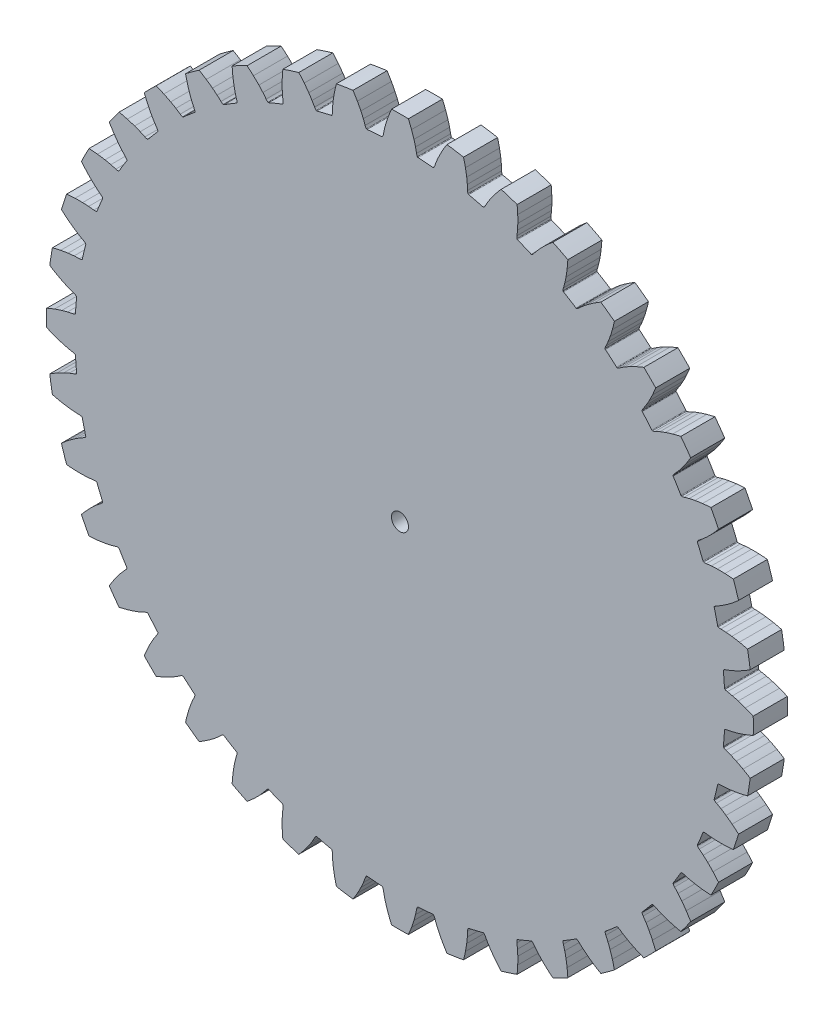
from build123d import *

# Parameters (mm, degrees)
BOSS_EXTRUDE1_DEPTH = 6.35
SKETCH2_R           = 1.5875
CUT_EXTRUDE1_DEPTH  = 94.418849447


with BuildPart() as part:
    # Model → Boss-Extrude1 (new body)
    with BuildSketch(Plane.XY):
        with BuildLine():
            ThreePointArc((60.432559989, -4.756145619), (60.482768647, -4.068159868), (60.525145286, -3.379647323))
            ThreePointArc((60.525145286, -3.379647323), (60.550130561, -3.301696422), (60.609923049, -3.245790562))
            ThreePointArc((60.609923049, -3.245790562), (60.826439878, -3.150337081), (61.055658386, -3.091602251))
            ThreePointArc((61.055658386, -3.091602251), (61.531607168, -3.002464951), (62.00435827, -2.897683768))
            ThreePointArc((62.00435827, -2.897683768), (62.546588484, -2.759880245), (63.084665609, -2.606660065))
            ThreePointArc((63.084665609, -2.606660065), (63.761308327, -2.391526525), (64.430648945, -2.154649038))
            ThreePointArc((64.430648945, -2.154649038), (65.162514979, -1.870027064), (65.885756381, -1.564152197))
            ThreePointArc((65.885756381, -1.564152197), (65.904320541, 0), (65.885756381, 1.564152197))
            ThreePointArc((65.885756381, 1.564152197), (65.162514976, 1.870027065), (64.430648939, 2.15464904))
            ThreePointArc((64.430648939, 2.15464904), (63.761308318, 2.391526528), (63.084665598, 2.606660069))
            ThreePointArc((63.084665598, 2.606660069), (62.546588471, 2.759880248), (62.004358256, 2.897683771))
            ThreePointArc((62.004358256, 2.897683771), (61.531607153, 3.002464954), (61.05565837, 3.091602254))
            ThreePointArc((61.05565837, 3.091602254), (60.82643988, 3.150337078), (60.609923065, 3.245790548))
            ThreePointArc((60.609923065, 3.245790548), (60.550130575, 3.301696402), (60.525145288, 3.379647296))
            ThreePointArc((60.525145288, 3.379647296), (60.43255999, 4.756145605), (60.308673633, 6.130180468))
            ThreePointArc((60.308673633, 6.130180468), (60.32115709, 6.211080222), (60.37146783, 6.275651394))
            ThreePointArc((60.37146783, 6.275651394), (60.570386763, 6.403800379), (60.78759506, 6.49766976))
            ThreePointArc((60.78759506, 6.49766976), (61.243739976, 6.660164425), (61.69427934, 6.837610144))
            ThreePointArc((61.69427934, 6.837610144), (62.20827658, 7.058540571), (62.715760166, 7.294048163))
            ThreePointArc((62.715760166, 7.294048163), (63.350417988, 7.612383294), (63.97446211, 7.951052367))
            ThreePointArc((63.97446211, 7.951052367), (64.652792972, 8.346659244), (65.319280701, 8.761908165))
            ThreePointArc((65.319280701, 8.761908165), (65.092928993, 10.309707128), (64.829906076, 11.851697941))
            ThreePointArc((64.829906076, 11.851697941), (64.067719602, 12.0406671), (63.300339364, 12.207295834))
            ThreePointArc((63.300339364, 12.207295834), (62.602183634, 12.336549025), (61.900217208, 12.443183673))
            ThreePointArc((61.900217208, 12.443183673), (61.344795787, 12.51034365), (60.787684105, 12.56162709))
            ThreePointArc((60.787684105, 12.56162709), (60.304361964, 12.591163676), (59.820328755, 12.604748755))
            ThreePointArc((59.820328755, 12.604748755), (59.584744174, 12.626902784), (59.355960828, 12.687310371))
            ThreePointArc((59.355960828, 12.687310371), (59.28815888, 12.733174325), (59.251286997, 12.806256954))
            ThreePointArc((59.251286997, 12.806256954), (58.944509801, 14.151324754), (58.607202282, 15.489062871))
            ThreePointArc((58.607202282, 15.489062871), (58.606876537, 15.570919457), (58.646466712, 15.642565985))
            ThreePointArc((58.646466712, 15.642565985), (58.822889705, 15.800255021), (59.0227394, 15.926947577))
            ThreePointArc((59.0227394, 15.926947577), (59.44784865, 16.158798449), (59.8650825, 16.404539401))
            ThreePointArc((59.8650825, 16.404539401), (60.338190448, 16.703156691), (60.802584565, 17.015152717))
            ThreePointArc((60.802584565, 17.015152717), (61.379630111, 17.428850971), (61.943011698, 17.860972475))
            ThreePointArc((61.943011698, 17.860972475), (62.551104632, 18.3578231), (63.144427548, 18.872221269))
            ThreePointArc((63.144427548, 18.872221269), (62.678733503, 20.36555505), (62.177728326, 21.847415549))
            ThreePointArc((62.177728326, 21.847415549), (61.395364343, 21.91482595), (60.611365352, 21.959358491))
            ThreePointArc((60.611365352, 21.959358491), (59.901585424, 21.977804742), (59.191580035, 21.973314798))
            ThreePointArc((59.191580035, 21.973314798), (58.632490638, 21.952760872), (58.074215428, 21.916261459))
            ThreePointArc((58.074215428, 21.916261459), (57.592223245, 21.869826161), (57.112024113, 21.807524509))
            ThreePointArc((57.112024113, 21.807524509), (56.875874316, 21.792552237), (56.640457844, 21.816426506))
            ThreePointArc((56.640457844, 21.816426506), (56.566315947, 21.851119237), (56.518465376, 21.917534065))
            ThreePointArc((56.518465376, 21.917534065), (56.005050155, 23.198051321), (55.462627105, 24.466553141))
            ThreePointArc((55.462627105, 24.466553141), (55.449500179, 24.547350979), (55.477394947, 24.624308687))
            ThreePointArc((55.477394947, 24.624308687), (55.62697788, 24.807654946), (55.804548012, 24.964051086))
            ThreePointArc((55.804548012, 24.964051086), (56.188153994, 25.259549228), (56.561808649, 25.567534455))
            ThreePointArc((56.561808649, 25.567534455), (56.982377817, 25.936485659), (57.39224754, 26.317287741))
            ThreePointArc((57.39224754, 26.317287741), (57.897472032, 26.816162495), (58.386318762, 27.331096163))
            ThreePointArc((58.386318762, 27.331096163), (58.9092005, 27.916956425), (59.414749024, 28.517837652))
            ThreePointArc((59.414749024, 28.517837652), (58.721179574, 29.919935417), (57.994528549, 31.305177278))
            ThreePointArc((57.994528549, 31.305177278), (57.211251454, 31.249369054), (56.429938368, 31.170708862))
            ThreePointArc((56.429938368, 31.170708862), (55.726011378, 31.077893966), (55.025449716, 30.962389988))
            ThreePointArc((55.025449716, 30.962389988), (54.47645898, 30.854628264), (53.930766831, 30.731244736))
            ThreePointArc((53.930766831, 30.731244736), (53.461972852, 30.609980944), (52.997431894, 30.473326634))
            ThreePointArc((52.997431894, 30.473326634), (52.766531672, 30.421596728), (52.530278809, 30.408349816))
            ThreePointArc((52.530278809, 30.408349816), (52.451622583, 30.431017074), (52.393971564, 30.489128746))
            ThreePointArc((52.393971564, 30.489128746), (51.686560304, 31.673564875), (50.952377978, 32.841595673))
            ThreePointArc((50.952377978, 32.841595673), (50.9267731, 32.919345252), (50.942285599, 32.999719186))
            ThreePointArc((50.942285599, 32.999719186), (51.061345244, 33.204208074), (51.212263446, 33.386456807))
            ThreePointArc((51.212263446, 33.386456807), (51.544920509, 33.738326073), (51.865795351, 34.100971957))
            ThreePointArc((51.865795351, 34.100971957), (52.22346993, 34.531172272), (52.568722907, 34.9714038))
            ThreePointArc((52.568722907, 34.9714038), (52.989686042, 35.5431711), (53.391960884, 36.128237557))
            ThreePointArc((53.391960884, 36.128237557), (53.816756344, 36.788681632), (54.222082193, 37.461250227))
            ThreePointArc((54.222082193, 37.461250227), (53.31771532, 38.737587676), (52.383311005, 39.992101646))
            ThreePointArc((52.383311005, 39.992101646), (51.618407681, 39.814448981), (50.859019021, 39.614532932))
            ThreePointArc((50.859019021, 39.614532932), (50.178277989, 39.4127423), (49.504410207, 39.189068378))
            ThreePointArc((49.504410207, 39.189068378), (48.979036105, 38.996752308), (48.459363768, 38.789522776))
            ThreePointArc((48.459363768, 38.789522776), (48.015311257, 38.596416407), (47.577867013, 38.388774323))
            ThreePointArc((47.577867013, 38.388774323), (47.357901896, 38.301560545), (47.126629971, 38.251518634))
            ThreePointArc((47.126629971, 38.251518634), (47.045396194, 38.261602276), (46.979364286, 38.309979891))
            ThreePointArc((46.979364286, 38.309979891), (46.095375801, 39.369170143), (45.187512204, 40.407969124))
            ThreePointArc((45.187512204, 40.407969124), (45.150059851, 40.480755991), (45.152808112, 40.562567078))
            ThreePointArc((45.152808112, 40.562567078), (45.238412826, 40.783163401), (45.358962991, 40.986777158))
            ThreePointArc((45.358962991, 40.986777158), (45.632480013, 41.386353359), (45.892674038, 41.794730354))
            ThreePointArc((45.892674038, 41.794730354), (46.178646894, 42.275586821), (46.45078185, 42.764407833))
            ThreePointArc((46.45078185, 42.764407833), (46.777118118, 43.394988872), (47.082915731, 44.03578184))
            ThreePointArc((47.082915731, 44.03578184), (47.399165039, 44.754547403), (47.694287746, 45.482242495))
            ThreePointArc((47.694287746, 45.482242495), (46.601391964, 46.601391964), (45.482242495, 47.694287746))
            ThreePointArc((45.482242495, 47.694287746), (44.7545474, 47.399165038), (44.035781834, 47.082915728))
            ThreePointArc((44.035781834, 47.082915728), (43.394988864, 46.777118114), (42.764407822, 46.450781844))
            ThreePointArc((42.764407822, 46.450781844), (42.275586809, 46.178646887), (41.794730341, 45.89267403))
            ThreePointArc((41.794730341, 45.89267403), (41.386353346, 45.632480004), (40.986777145, 45.358962982))
            ThreePointArc((40.986777145, 45.358962982), (40.783163404, 45.238412825), (40.5625671, 45.152808114))
            ThreePointArc((40.5625671, 45.152808114), (40.480756016, 45.150059846), (40.407969144, 45.187512186))
            ThreePointArc((40.407969144, 45.187512186), (39.369170163, 46.095375783), (38.309979911, 46.979364269))
            ThreePointArc((38.309979911, 46.979364269), (38.261602284, 47.04539617), (38.251518636, 47.12662995))
            ThreePointArc((38.251518636, 47.12662995), (38.301560546, 47.357901893), (38.38877433, 47.577867028))
            ThreePointArc((38.38877433, 47.577867028), (38.596416414, 48.015311271), (38.789522782, 48.459363781))
            ThreePointArc((38.789522782, 48.459363781), (38.996752313, 48.979036118), (39.189068382, 49.504410218))
            ThreePointArc((39.189068382, 49.504410218), (39.412742303, 50.178277998), (39.614532934, 50.859019027))
            ThreePointArc((39.614532934, 50.859019027), (39.814448982, 51.618407685), (39.992101646, 52.383311005))
            ThreePointArc((39.992101646, 52.383311005), (38.737587676, 53.31771532), (37.461250227, 54.222082193))
            ThreePointArc((37.461250227, 54.222082193), (36.788681629, 53.816756342), (36.128237552, 53.39196088))
            ThreePointArc((36.128237552, 53.39196088), (35.543171093, 52.989686036), (34.97140379, 52.568722899))
            ThreePointArc((34.97140379, 52.568722899), (34.531172261, 52.223469921), (34.100971945, 51.865795341))
            ThreePointArc((34.100971945, 51.865795341), (33.738326061, 51.544920498), (33.386456796, 51.212263435))
            ThreePointArc((33.386456796, 51.212263435), (33.204208077, 51.061345244), (32.999719207, 50.942285604))
            ThreePointArc((32.999719207, 50.942285604), (32.919345277, 50.926773099), (32.841595695, 50.952377963))
            ThreePointArc((32.841595695, 50.952377963), (31.673564898, 51.68656029), (30.48912877, 52.39397155))
            ThreePointArc((30.48912877, 52.39397155), (30.431017086, 52.451622561), (30.408349821, 52.530278788))
            ThreePointArc((30.408349821, 52.530278788), (30.42159673, 52.766531669), (30.473326639, 52.997431909))
            ThreePointArc((30.473326639, 52.997431909), (30.609980948, 53.461972867), (30.731244739, 53.930766845))
            ThreePointArc((30.731244739, 53.930766845), (30.854628267, 54.476458994), (30.96238999, 55.025449729))
            ThreePointArc((30.96238999, 55.025449729), (31.077893968, 55.726011388), (31.170708863, 56.429938375))
            ThreePointArc((31.170708863, 56.429938375), (31.249369054, 57.211251458), (31.305177278, 57.994528549))
            ThreePointArc((31.305177278, 57.994528549), (29.919935417, 58.721179574), (28.517837652, 59.414749024))
            ThreePointArc((28.517837652, 59.414749024), (27.916956423, 58.909200498), (27.331096158, 58.386318757))
            ThreePointArc((27.331096158, 58.386318757), (26.816162488, 57.897472026), (26.317287733, 57.392247531))
            ThreePointArc((26.317287733, 57.392247531), (25.93648565, 56.982377807), (25.567534445, 56.561808638))
            ThreePointArc((25.567534445, 56.561808638), (25.259549218, 56.188153982), (24.964051077, 55.804547999))
            ThreePointArc((24.964051077, 55.804547999), (24.807654948, 55.626977881), (24.624308707, 55.477394955))
            ThreePointArc((24.624308707, 55.477394955), (24.547351004, 55.449500182), (24.466553165, 55.462627094))
            ThreePointArc((24.466553165, 55.462627094), (23.198051346, 56.005050144), (21.91753409, 56.518465366))
            ThreePointArc((21.91753409, 56.518465366), (21.851119252, 56.566315927), (21.816426515, 56.640457824))
            ThreePointArc((21.816426515, 56.640457824), (21.792552239, 56.875874313), (21.807524511, 57.112024129))
            ThreePointArc((21.807524511, 57.112024129), (21.869826163, 57.59222326), (21.91626146, 58.074215443))
            ThreePointArc((21.91626146, 58.074215443), (21.952760873, 58.632490652), (21.973314799, 59.191580047))
            ThreePointArc((21.973314799, 59.191580047), (21.977804742, 59.901585433), (21.95935849, 60.611365359))
            ThreePointArc((21.95935849, 60.611365359), (21.91482595, 61.395364346), (21.847415549, 62.177728326))
            ThreePointArc((21.847415549, 62.177728326), (20.36555505, 62.678733503), (18.872221269, 63.144427548))
            ThreePointArc((18.872221269, 63.144427548), (18.357823098, 62.551104629), (17.860972471, 61.943011693))
            ThreePointArc((17.860972471, 61.943011693), (17.428850966, 61.379630103), (17.01515271, 60.802584555))
            ThreePointArc((17.01515271, 60.802584555), (16.703156684, 60.338190437), (16.404539394, 59.865082488))
            ThreePointArc((16.404539394, 59.865082488), (16.158798442, 59.447848637), (15.92694757, 59.022739386))
            ThreePointArc((15.92694757, 59.022739386), (15.800255024, 58.822889706), (15.642566004, 58.646466723))
            ThreePointArc((15.642566004, 58.646466723), (15.570919481, 58.606876544), (15.489062897, 58.607202275))
            ThreePointArc((15.489062897, 58.607202275), (14.15132478, 58.944509794), (12.806256981, 59.251286991))
            ThreePointArc((12.806256981, 59.251286991), (12.733174343, 59.288158863), (12.687310383, 59.35596081))
            ThreePointArc((12.687310383, 59.35596081), (12.626902786, 59.584744172), (12.604748755, 59.820328771))
            ThreePointArc((12.604748755, 59.820328771), (12.591163676, 60.304361979), (12.561627088, 60.78768412))
            ThreePointArc((12.561627088, 60.78768412), (12.510343649, 61.3447958), (12.443183671, 61.90021722))
            ThreePointArc((12.443183671, 61.90021722), (12.336549023, 62.602183643), (12.207295833, 63.300339371))
            ThreePointArc((12.207295833, 63.300339371), (12.040667099, 64.067719605), (11.851697941, 64.829906076))
            ThreePointArc((11.851697941, 64.829906076), (10.309707128, 65.092928993), (8.761908165, 65.319280701))
            ThreePointArc((8.761908165, 65.319280701), (8.346659242, 64.652792969), (7.951052364, 63.974462104))
            ThreePointArc((7.951052364, 63.974462104), (7.612383289, 63.35041798), (7.294048157, 62.715760155))
            ThreePointArc((7.294048157, 62.715760155), (7.058540565, 62.208276567), (6.837610138, 61.694279326))
            ThreePointArc((6.837610138, 61.694279326), (6.66016442, 61.243739962), (6.497669755, 60.787595044))
            ThreePointArc((6.497669755, 60.787595044), (6.403800382, 60.570386765), (6.27565141, 60.371467844))
            ThreePointArc((6.27565141, 60.371467844), (6.211080244, 60.3211571), (6.130180495, 60.30867363))
            ThreePointArc((6.130180495, 60.30867363), (4.756145632, 60.432559988), (3.379647323, 60.525145286))
            ThreePointArc((3.379647323, 60.525145286), (3.301696422, 60.550130561), (3.245790562, 60.609923049))
            ThreePointArc((3.245790562, 60.609923049), (3.150337081, 60.826439878), (3.091602251, 61.055658386))
            ThreePointArc((3.091602251, 61.055658386), (3.002464951, 61.531607168), (2.897683768, 62.00435827))
            ThreePointArc((2.897683768, 62.00435827), (2.759880245, 62.546588484), (2.606660065, 63.084665609))
            ThreePointArc((2.606660065, 63.084665609), (2.391526525, 63.761308327), (2.154649038, 64.430648945))
            ThreePointArc((2.154649038, 64.430648945), (1.870027064, 65.162514979), (1.564152197, 65.885756381))
            ThreePointArc((1.564152197, 65.885756381), (0, 65.904320541), (-1.564152197, 65.885756381))
            ThreePointArc((-1.564152197, 65.885756381), (-1.870027065, 65.162514976), (-2.15464904, 64.430648939))
            ThreePointArc((-2.15464904, 64.430648939), (-2.391526528, 63.761308318), (-2.606660069, 63.084665598))
            ThreePointArc((-2.606660069, 63.084665598), (-2.759880248, 62.546588471), (-2.897683771, 62.004358256))
            ThreePointArc((-2.897683771, 62.004358256), (-3.002464954, 61.531607153), (-3.091602254, 61.05565837))
            ThreePointArc((-3.091602254, 61.05565837), (-3.150337078, 60.82643988), (-3.245790548, 60.609923065))
            ThreePointArc((-3.245790548, 60.609923065), (-3.301696402, 60.550130575), (-3.379647296, 60.525145288))
            ThreePointArc((-3.379647296, 60.525145288), (-4.756145605, 60.43255999), (-6.130180468, 60.308673633))
            ThreePointArc((-6.130180468, 60.308673633), (-6.211080222, 60.32115709), (-6.275651394, 60.37146783))
            ThreePointArc((-6.275651394, 60.37146783), (-6.403800379, 60.570386763), (-6.49766976, 60.78759506))
            ThreePointArc((-6.49766976, 60.78759506), (-6.660164425, 61.243739976), (-6.837610144, 61.69427934))
            ThreePointArc((-6.837610144, 61.69427934), (-7.058540571, 62.20827658), (-7.294048163, 62.715760166))
            ThreePointArc((-7.294048163, 62.715760166), (-7.612383294, 63.350417988), (-7.951052367, 63.97446211))
            ThreePointArc((-7.951052367, 63.97446211), (-8.346659244, 64.652792972), (-8.761908165, 65.319280701))
            ThreePointArc((-8.761908165, 65.319280701), (-10.309707128, 65.092928993), (-11.851697941, 64.829906076))
            ThreePointArc((-11.851697941, 64.829906076), (-12.0406671, 64.067719602), (-12.207295834, 63.300339364))
            ThreePointArc((-12.207295834, 63.300339364), (-12.336549025, 62.602183634), (-12.443183673, 61.900217208))
            ThreePointArc((-12.443183673, 61.900217208), (-12.51034365, 61.344795787), (-12.56162709, 60.787684105))
            ThreePointArc((-12.56162709, 60.787684105), (-12.591163676, 60.304361964), (-12.604748755, 59.820328755))
            ThreePointArc((-12.604748755, 59.820328755), (-12.626902784, 59.584744174), (-12.687310371, 59.355960828))
            ThreePointArc((-12.687310371, 59.355960828), (-12.733174325, 59.28815888), (-12.806256954, 59.251286997))
            ThreePointArc((-12.806256954, 59.251286997), (-14.151324754, 58.944509801), (-15.489062871, 58.607202282))
            ThreePointArc((-15.489062871, 58.607202282), (-15.570919457, 58.606876537), (-15.642565985, 58.646466712))
            ThreePointArc((-15.642565985, 58.646466712), (-15.800255021, 58.822889705), (-15.926947577, 59.0227394))
            ThreePointArc((-15.926947577, 59.0227394), (-16.158798449, 59.44784865), (-16.404539401, 59.8650825))
            ThreePointArc((-16.404539401, 59.8650825), (-16.703156691, 60.338190448), (-17.015152717, 60.802584565))
            ThreePointArc((-17.015152717, 60.802584565), (-17.428850971, 61.379630111), (-17.860972475, 61.943011698))
            ThreePointArc((-17.860972475, 61.943011698), (-18.3578231, 62.551104632), (-18.872221269, 63.144427548))
            ThreePointArc((-18.872221269, 63.144427548), (-20.36555505, 62.678733503), (-21.847415549, 62.177728326))
            ThreePointArc((-21.847415549, 62.177728326), (-21.91482595, 61.395364343), (-21.959358491, 60.611365352))
            ThreePointArc((-21.959358491, 60.611365352), (-21.977804742, 59.901585424), (-21.973314798, 59.191580035))
            ThreePointArc((-21.973314798, 59.191580035), (-21.952760872, 58.632490638), (-21.916261459, 58.074215428))
            ThreePointArc((-21.916261459, 58.074215428), (-21.869826161, 57.592223245), (-21.807524509, 57.112024113))
            ThreePointArc((-21.807524509, 57.112024113), (-21.792552237, 56.875874316), (-21.816426506, 56.640457844))
            ThreePointArc((-21.816426506, 56.640457844), (-21.851119237, 56.566315947), (-21.917534065, 56.518465376))
            ThreePointArc((-21.917534065, 56.518465376), (-23.198051321, 56.005050155), (-24.466553141, 55.462627105))
            ThreePointArc((-24.466553141, 55.462627105), (-24.547350979, 55.449500179), (-24.624308687, 55.477394947))
            ThreePointArc((-24.624308687, 55.477394947), (-24.807654946, 55.62697788), (-24.964051086, 55.804548012))
            ThreePointArc((-24.964051086, 55.804548012), (-25.259549228, 56.188153994), (-25.567534455, 56.561808649))
            ThreePointArc((-25.567534455, 56.561808649), (-25.936485659, 56.982377817), (-26.317287741, 57.39224754))
            ThreePointArc((-26.317287741, 57.39224754), (-26.816162495, 57.897472032), (-27.331096163, 58.386318762))
            ThreePointArc((-27.331096163, 58.386318762), (-27.916956425, 58.9092005), (-28.517837652, 59.414749024))
            ThreePointArc((-28.517837652, 59.414749024), (-29.919935417, 58.721179574), (-31.305177278, 57.994528549))
            ThreePointArc((-31.305177278, 57.994528549), (-31.249369054, 57.211251454), (-31.170708862, 56.429938368))
            ThreePointArc((-31.170708862, 56.429938368), (-31.077893966, 55.726011378), (-30.962389988, 55.025449716))
            ThreePointArc((-30.962389988, 55.025449716), (-30.854628264, 54.47645898), (-30.731244736, 53.930766831))
            ThreePointArc((-30.731244736, 53.930766831), (-30.609980944, 53.461972852), (-30.473326634, 52.997431894))
            ThreePointArc((-30.473326634, 52.997431894), (-30.421596728, 52.766531672), (-30.408349816, 52.530278809))
            ThreePointArc((-30.408349816, 52.530278809), (-30.431017074, 52.451622583), (-30.489128746, 52.393971564))
            ThreePointArc((-30.489128746, 52.393971564), (-31.673564875, 51.686560304), (-32.841595673, 50.952377978))
            ThreePointArc((-32.841595673, 50.952377978), (-32.919345252, 50.9267731), (-32.999719186, 50.942285599))
            ThreePointArc((-32.999719186, 50.942285599), (-33.204208074, 51.061345244), (-33.386456807, 51.212263446))
            ThreePointArc((-33.386456807, 51.212263446), (-33.738326073, 51.544920509), (-34.100971957, 51.865795351))
            ThreePointArc((-34.100971957, 51.865795351), (-34.531172272, 52.22346993), (-34.9714038, 52.568722907))
            ThreePointArc((-34.9714038, 52.568722907), (-35.5431711, 52.989686042), (-36.128237557, 53.391960884))
            ThreePointArc((-36.128237557, 53.391960884), (-36.788681632, 53.816756344), (-37.461250227, 54.222082193))
            ThreePointArc((-37.461250227, 54.222082193), (-38.737587676, 53.31771532), (-39.992101646, 52.383311005))
            ThreePointArc((-39.992101646, 52.383311005), (-39.814448981, 51.618407681), (-39.614532932, 50.859019021))
            ThreePointArc((-39.614532932, 50.859019021), (-39.4127423, 50.178277989), (-39.189068378, 49.504410207))
            ThreePointArc((-39.189068378, 49.504410207), (-38.996752308, 48.979036105), (-38.789522776, 48.459363768))
            ThreePointArc((-38.789522776, 48.459363768), (-38.596416407, 48.015311257), (-38.388774323, 47.577867013))
            ThreePointArc((-38.388774323, 47.577867013), (-38.301560545, 47.357901896), (-38.251518634, 47.126629971))
            ThreePointArc((-38.251518634, 47.126629971), (-38.261602276, 47.045396194), (-38.309979891, 46.979364286))
            ThreePointArc((-38.309979891, 46.979364286), (-39.369170143, 46.095375801), (-40.407969124, 45.187512204))
            ThreePointArc((-40.407969124, 45.187512204), (-40.480755991, 45.150059851), (-40.562567078, 45.152808112))
            ThreePointArc((-40.562567078, 45.152808112), (-40.783163401, 45.238412826), (-40.986777158, 45.358962991))
            ThreePointArc((-40.986777158, 45.358962991), (-41.386353359, 45.632480013), (-41.794730354, 45.892674038))
            ThreePointArc((-41.794730354, 45.892674038), (-42.275586821, 46.178646894), (-42.764407833, 46.45078185))
            ThreePointArc((-42.764407833, 46.45078185), (-43.394988872, 46.777118118), (-44.03578184, 47.082915731))
            ThreePointArc((-44.03578184, 47.082915731), (-44.754547403, 47.399165039), (-45.482242495, 47.694287746))
            ThreePointArc((-45.482242495, 47.694287746), (-46.601391964, 46.601391964), (-47.694287746, 45.482242495))
            ThreePointArc((-47.694287746, 45.482242495), (-47.399165038, 44.7545474), (-47.082915728, 44.035781834))
            ThreePointArc((-47.082915728, 44.035781834), (-46.777118114, 43.394988864), (-46.450781844, 42.764407822))
            ThreePointArc((-46.450781844, 42.764407822), (-46.178646887, 42.275586809), (-45.89267403, 41.794730341))
            ThreePointArc((-45.89267403, 41.794730341), (-45.632480004, 41.386353346), (-45.358962982, 40.986777145))
            ThreePointArc((-45.358962982, 40.986777145), (-45.238412825, 40.783163404), (-45.152808114, 40.5625671))
            ThreePointArc((-45.152808114, 40.5625671), (-45.150059846, 40.480756016), (-45.187512186, 40.407969144))
            ThreePointArc((-45.187512186, 40.407969144), (-46.095375783, 39.369170163), (-46.979364269, 38.309979911))
            ThreePointArc((-46.979364269, 38.309979911), (-47.04539617, 38.261602284), (-47.12662995, 38.251518636))
            ThreePointArc((-47.12662995, 38.251518636), (-47.357901893, 38.301560546), (-47.577867028, 38.38877433))
            ThreePointArc((-47.577867028, 38.38877433), (-48.015311271, 38.596416414), (-48.459363781, 38.789522782))
            ThreePointArc((-48.459363781, 38.789522782), (-48.979036118, 38.996752313), (-49.504410218, 39.189068382))
            ThreePointArc((-49.504410218, 39.189068382), (-50.178277998, 39.412742303), (-50.859019027, 39.614532934))
            ThreePointArc((-50.859019027, 39.614532934), (-51.618407685, 39.814448982), (-52.383311005, 39.992101646))
            ThreePointArc((-52.383311005, 39.992101646), (-53.31771532, 38.737587676), (-54.222082193, 37.461250227))
            ThreePointArc((-54.222082193, 37.461250227), (-53.816756342, 36.788681629), (-53.39196088, 36.128237552))
            ThreePointArc((-53.39196088, 36.128237552), (-52.989686036, 35.543171093), (-52.568722899, 34.97140379))
            ThreePointArc((-52.568722899, 34.97140379), (-52.223469921, 34.531172261), (-51.865795341, 34.100971945))
            ThreePointArc((-51.865795341, 34.100971945), (-51.544920498, 33.738326061), (-51.212263435, 33.386456796))
            ThreePointArc((-51.212263435, 33.386456796), (-51.061345244, 33.204208077), (-50.942285604, 32.999719207))
            ThreePointArc((-50.942285604, 32.999719207), (-50.926773099, 32.919345277), (-50.952377963, 32.841595695))
            ThreePointArc((-50.952377963, 32.841595695), (-51.68656029, 31.673564898), (-52.39397155, 30.48912877))
            ThreePointArc((-52.39397155, 30.48912877), (-52.451622561, 30.431017086), (-52.530278788, 30.408349821))
            ThreePointArc((-52.530278788, 30.408349821), (-52.766531669, 30.42159673), (-52.997431909, 30.473326639))
            ThreePointArc((-52.997431909, 30.473326639), (-53.461972867, 30.609980948), (-53.930766845, 30.731244739))
            ThreePointArc((-53.930766845, 30.731244739), (-54.476458994, 30.854628267), (-55.025449729, 30.96238999))
            ThreePointArc((-55.025449729, 30.96238999), (-55.726011388, 31.077893968), (-56.429938375, 31.170708863))
            ThreePointArc((-56.429938375, 31.170708863), (-57.211251458, 31.249369054), (-57.994528549, 31.305177278))
            ThreePointArc((-57.994528549, 31.305177278), (-58.721179574, 29.919935417), (-59.414749024, 28.517837652))
            ThreePointArc((-59.414749024, 28.517837652), (-58.909200498, 27.916956423), (-58.386318757, 27.331096158))
            ThreePointArc((-58.386318757, 27.331096158), (-57.897472026, 26.816162488), (-57.392247531, 26.317287733))
            ThreePointArc((-57.392247531, 26.317287733), (-56.982377807, 25.93648565), (-56.561808638, 25.567534445))
            ThreePointArc((-56.561808638, 25.567534445), (-56.188153982, 25.259549218), (-55.804547999, 24.964051077))
            ThreePointArc((-55.804547999, 24.964051077), (-55.626977881, 24.807654948), (-55.477394955, 24.624308707))
            ThreePointArc((-55.477394955, 24.624308707), (-55.449500182, 24.547351004), (-55.462627094, 24.466553165))
            ThreePointArc((-55.462627094, 24.466553165), (-56.005050144, 23.198051346), (-56.518465366, 21.91753409))
            ThreePointArc((-56.518465366, 21.91753409), (-56.566315927, 21.851119252), (-56.640457824, 21.816426515))
            ThreePointArc((-56.640457824, 21.816426515), (-56.875874313, 21.792552239), (-57.112024129, 21.807524511))
            ThreePointArc((-57.112024129, 21.807524511), (-57.59222326, 21.869826163), (-58.074215443, 21.91626146))
            ThreePointArc((-58.074215443, 21.91626146), (-58.632490652, 21.952760873), (-59.191580047, 21.973314799))
            ThreePointArc((-59.191580047, 21.973314799), (-59.901585433, 21.977804742), (-60.611365359, 21.95935849))
            ThreePointArc((-60.611365359, 21.95935849), (-61.395364346, 21.91482595), (-62.177728326, 21.847415549))
            ThreePointArc((-62.177728326, 21.847415549), (-62.678733503, 20.36555505), (-63.144427548, 18.872221269))
            ThreePointArc((-63.144427548, 18.872221269), (-62.551104629, 18.357823098), (-61.943011693, 17.860972471))
            ThreePointArc((-61.943011693, 17.860972471), (-61.379630103, 17.428850966), (-60.802584555, 17.01515271))
            ThreePointArc((-60.802584555, 17.01515271), (-60.338190437, 16.703156684), (-59.865082488, 16.404539394))
            ThreePointArc((-59.865082488, 16.404539394), (-59.447848637, 16.158798442), (-59.022739386, 15.92694757))
            ThreePointArc((-59.022739386, 15.92694757), (-58.822889706, 15.800255024), (-58.646466723, 15.642566004))
            ThreePointArc((-58.646466723, 15.642566004), (-58.606876544, 15.570919481), (-58.607202275, 15.489062897))
            ThreePointArc((-58.607202275, 15.489062897), (-58.944509794, 14.15132478), (-59.251286991, 12.806256981))
            ThreePointArc((-59.251286991, 12.806256981), (-59.288158863, 12.733174343), (-59.35596081, 12.687310383))
            ThreePointArc((-59.35596081, 12.687310383), (-59.584744172, 12.626902786), (-59.820328771, 12.604748755))
            ThreePointArc((-59.820328771, 12.604748755), (-60.304361979, 12.591163676), (-60.78768412, 12.561627088))
            ThreePointArc((-60.78768412, 12.561627088), (-61.3447958, 12.510343649), (-61.90021722, 12.443183671))
            ThreePointArc((-61.90021722, 12.443183671), (-62.602183643, 12.336549023), (-63.300339371, 12.207295833))
            ThreePointArc((-63.300339371, 12.207295833), (-64.067719605, 12.040667099), (-64.829906076, 11.851697941))
            ThreePointArc((-64.829906076, 11.851697941), (-65.092928993, 10.309707128), (-65.319280701, 8.761908165))
            ThreePointArc((-65.319280701, 8.761908165), (-64.652792969, 8.346659242), (-63.974462104, 7.951052364))
            ThreePointArc((-63.974462104, 7.951052364), (-63.35041798, 7.612383289), (-62.715760155, 7.294048157))
            ThreePointArc((-62.715760155, 7.294048157), (-62.208276567, 7.058540565), (-61.694279326, 6.837610138))
            ThreePointArc((-61.694279326, 6.837610138), (-61.243739962, 6.66016442), (-60.787595044, 6.497669755))
            ThreePointArc((-60.787595044, 6.497669755), (-60.570386765, 6.403800382), (-60.371467844, 6.27565141))
            ThreePointArc((-60.371467844, 6.27565141), (-60.3211571, 6.211080244), (-60.30867363, 6.130180495))
            ThreePointArc((-60.30867363, 6.130180495), (-60.432559988, 4.756145632), (-60.525145286, 3.379647323))
            ThreePointArc((-60.525145286, 3.379647323), (-60.550130561, 3.301696422), (-60.609923049, 3.245790562))
            ThreePointArc((-60.609923049, 3.245790562), (-60.826439878, 3.150337081), (-61.055658386, 3.091602251))
            ThreePointArc((-61.055658386, 3.091602251), (-61.531607168, 3.002464951), (-62.00435827, 2.897683768))
            ThreePointArc((-62.00435827, 2.897683768), (-62.546588484, 2.759880245), (-63.084665609, 2.606660065))
            ThreePointArc((-63.084665609, 2.606660065), (-63.761308327, 2.391526525), (-64.430648945, 2.154649038))
            ThreePointArc((-64.430648945, 2.154649038), (-65.162514979, 1.870027064), (-65.885756381, 1.564152197))
            ThreePointArc((-65.885756381, 1.564152197), (-65.904320541, 0), (-65.885756381, -1.564152197))
            ThreePointArc((-65.885756381, -1.564152197), (-65.162514976, -1.870027065), (-64.430648939, -2.15464904))
            ThreePointArc((-64.430648939, -2.15464904), (-63.761308318, -2.391526528), (-63.084665598, -2.606660069))
            ThreePointArc((-63.084665598, -2.606660069), (-62.546588471, -2.759880248), (-62.004358256, -2.897683771))
            ThreePointArc((-62.004358256, -2.897683771), (-61.531607153, -3.002464954), (-61.05565837, -3.091602254))
            ThreePointArc((-61.05565837, -3.091602254), (-60.82643988, -3.150337078), (-60.609923065, -3.245790548))
            ThreePointArc((-60.609923065, -3.245790548), (-60.550130575, -3.301696402), (-60.525145288, -3.379647296))
            ThreePointArc((-60.525145288, -3.379647296), (-60.43255999, -4.756145605), (-60.308673633, -6.130180468))
            ThreePointArc((-60.308673633, -6.130180468), (-60.32115709, -6.211080222), (-60.37146783, -6.275651394))
            ThreePointArc((-60.37146783, -6.275651394), (-60.570386763, -6.403800379), (-60.78759506, -6.49766976))
            ThreePointArc((-60.78759506, -6.49766976), (-61.243739976, -6.660164425), (-61.69427934, -6.837610144))
            ThreePointArc((-61.69427934, -6.837610144), (-62.20827658, -7.058540571), (-62.715760166, -7.294048163))
            ThreePointArc((-62.715760166, -7.294048163), (-63.350417988, -7.612383294), (-63.97446211, -7.951052367))
            ThreePointArc((-63.97446211, -7.951052367), (-64.652792972, -8.346659244), (-65.319280701, -8.761908165))
            ThreePointArc((-65.319280701, -8.761908165), (-65.092928993, -10.309707128), (-64.829906076, -11.851697941))
            ThreePointArc((-64.829906076, -11.851697941), (-64.067719602, -12.0406671), (-63.300339364, -12.207295834))
            ThreePointArc((-63.300339364, -12.207295834), (-62.602183634, -12.336549025), (-61.900217208, -12.443183673))
            ThreePointArc((-61.900217208, -12.443183673), (-61.344795787, -12.51034365), (-60.787684105, -12.56162709))
            ThreePointArc((-60.787684105, -12.56162709), (-60.304361964, -12.591163676), (-59.820328755, -12.604748755))
            ThreePointArc((-59.820328755, -12.604748755), (-59.584744174, -12.626902784), (-59.355960828, -12.687310371))
            ThreePointArc((-59.355960828, -12.687310371), (-59.28815888, -12.733174325), (-59.251286997, -12.806256954))
            ThreePointArc((-59.251286997, -12.806256954), (-58.944509801, -14.151324754), (-58.607202282, -15.489062871))
            ThreePointArc((-58.607202282, -15.489062871), (-58.606876537, -15.570919457), (-58.646466712, -15.642565985))
            ThreePointArc((-58.646466712, -15.642565985), (-58.822889705, -15.800255021), (-59.0227394, -15.926947577))
            ThreePointArc((-59.0227394, -15.926947577), (-59.44784865, -16.158798449), (-59.8650825, -16.404539401))
            ThreePointArc((-59.8650825, -16.404539401), (-60.338190448, -16.703156691), (-60.802584565, -17.015152717))
            ThreePointArc((-60.802584565, -17.015152717), (-61.379630111, -17.428850971), (-61.943011698, -17.860972475))
            ThreePointArc((-61.943011698, -17.860972475), (-62.551104632, -18.3578231), (-63.144427548, -18.872221269))
            ThreePointArc((-63.144427548, -18.872221269), (-62.678733503, -20.36555505), (-62.177728326, -21.847415549))
            ThreePointArc((-62.177728326, -21.847415549), (-61.395364343, -21.91482595), (-60.611365352, -21.959358491))
            ThreePointArc((-60.611365352, -21.959358491), (-59.901585424, -21.977804742), (-59.191580035, -21.973314798))
            ThreePointArc((-59.191580035, -21.973314798), (-58.632490638, -21.952760872), (-58.074215428, -21.916261459))
            ThreePointArc((-58.074215428, -21.916261459), (-57.592223245, -21.869826161), (-57.112024113, -21.807524509))
            ThreePointArc((-57.112024113, -21.807524509), (-56.875874316, -21.792552237), (-56.640457844, -21.816426506))
            ThreePointArc((-56.640457844, -21.816426506), (-56.566315947, -21.851119237), (-56.518465376, -21.917534065))
            ThreePointArc((-56.518465376, -21.917534065), (-56.005050155, -23.198051321), (-55.462627105, -24.466553141))
            ThreePointArc((-55.462627105, -24.466553141), (-55.449500179, -24.547350979), (-55.477394947, -24.624308687))
            ThreePointArc((-55.477394947, -24.624308687), (-55.62697788, -24.807654946), (-55.804548012, -24.964051086))
            ThreePointArc((-55.804548012, -24.964051086), (-56.188153994, -25.259549228), (-56.561808649, -25.567534455))
            ThreePointArc((-56.561808649, -25.567534455), (-56.982377817, -25.936485659), (-57.39224754, -26.317287741))
            ThreePointArc((-57.39224754, -26.317287741), (-57.897472032, -26.816162495), (-58.386318762, -27.331096163))
            ThreePointArc((-58.386318762, -27.331096163), (-58.9092005, -27.916956425), (-59.414749024, -28.517837652))
            ThreePointArc((-59.414749024, -28.517837652), (-58.721179574, -29.919935417), (-57.994528549, -31.305177278))
            ThreePointArc((-57.994528549, -31.305177278), (-57.211251454, -31.249369054), (-56.429938368, -31.170708862))
            ThreePointArc((-56.429938368, -31.170708862), (-55.726011378, -31.077893966), (-55.025449716, -30.962389988))
            ThreePointArc((-55.025449716, -30.962389988), (-54.47645898, -30.854628264), (-53.930766831, -30.731244736))
            ThreePointArc((-53.930766831, -30.731244736), (-53.461972852, -30.609980944), (-52.997431894, -30.473326634))
            ThreePointArc((-52.997431894, -30.473326634), (-52.766531672, -30.421596728), (-52.530278809, -30.408349816))
            ThreePointArc((-52.530278809, -30.408349816), (-52.451622583, -30.431017074), (-52.393971564, -30.489128746))
            ThreePointArc((-52.393971564, -30.489128746), (-51.686560304, -31.673564875), (-50.952377978, -32.841595673))
            ThreePointArc((-50.952377978, -32.841595673), (-50.9267731, -32.919345252), (-50.942285599, -32.999719186))
            ThreePointArc((-50.942285599, -32.999719186), (-51.061345244, -33.204208074), (-51.212263446, -33.386456807))
            ThreePointArc((-51.212263446, -33.386456807), (-51.544920509, -33.738326073), (-51.865795351, -34.100971957))
            ThreePointArc((-51.865795351, -34.100971957), (-52.22346993, -34.531172272), (-52.568722907, -34.9714038))
            ThreePointArc((-52.568722907, -34.9714038), (-52.989686042, -35.5431711), (-53.391960884, -36.128237557))
            ThreePointArc((-53.391960884, -36.128237557), (-53.816756344, -36.788681632), (-54.222082193, -37.461250227))
            ThreePointArc((-54.222082193, -37.461250227), (-53.31771532, -38.737587676), (-52.383311005, -39.992101646))
            ThreePointArc((-52.383311005, -39.992101646), (-51.618407681, -39.814448981), (-50.859019021, -39.614532932))
            ThreePointArc((-50.859019021, -39.614532932), (-50.178277989, -39.4127423), (-49.504410207, -39.189068378))
            ThreePointArc((-49.504410207, -39.189068378), (-48.979036105, -38.996752308), (-48.459363768, -38.789522776))
            ThreePointArc((-48.459363768, -38.789522776), (-48.015311257, -38.596416407), (-47.577867013, -38.388774323))
            ThreePointArc((-47.577867013, -38.388774323), (-47.357901896, -38.301560545), (-47.126629971, -38.251518634))
            ThreePointArc((-47.126629971, -38.251518634), (-47.045396194, -38.261602276), (-46.979364286, -38.309979891))
            ThreePointArc((-46.979364286, -38.309979891), (-46.095375801, -39.369170143), (-45.187512204, -40.407969124))
            ThreePointArc((-45.187512204, -40.407969124), (-45.150059851, -40.480755991), (-45.152808112, -40.562567078))
            ThreePointArc((-45.152808112, -40.562567078), (-45.238412826, -40.783163401), (-45.358962991, -40.986777158))
            ThreePointArc((-45.358962991, -40.986777158), (-45.632480013, -41.386353359), (-45.892674038, -41.794730354))
            ThreePointArc((-45.892674038, -41.794730354), (-46.178646894, -42.275586821), (-46.45078185, -42.764407833))
            ThreePointArc((-46.45078185, -42.764407833), (-46.777118118, -43.394988872), (-47.082915731, -44.03578184))
            ThreePointArc((-47.082915731, -44.03578184), (-47.399165039, -44.754547403), (-47.694287746, -45.482242495))
            ThreePointArc((-47.694287746, -45.482242495), (-46.601391964, -46.601391964), (-45.482242495, -47.694287746))
            ThreePointArc((-45.482242495, -47.694287746), (-44.7545474, -47.399165038), (-44.035781834, -47.082915728))
            ThreePointArc((-44.035781834, -47.082915728), (-43.394988864, -46.777118114), (-42.764407822, -46.450781844))
            ThreePointArc((-42.764407822, -46.450781844), (-42.275586809, -46.178646887), (-41.794730341, -45.89267403))
            ThreePointArc((-41.794730341, -45.89267403), (-41.386353346, -45.632480004), (-40.986777145, -45.358962982))
            ThreePointArc((-40.986777145, -45.358962982), (-40.783163404, -45.238412825), (-40.5625671, -45.152808114))
            ThreePointArc((-40.5625671, -45.152808114), (-40.480756016, -45.150059846), (-40.407969144, -45.187512186))
            ThreePointArc((-40.407969144, -45.187512186), (-39.369170163, -46.095375783), (-38.309979911, -46.979364269))
            ThreePointArc((-38.309979911, -46.979364269), (-38.261602284, -47.04539617), (-38.251518636, -47.12662995))
            ThreePointArc((-38.251518636, -47.12662995), (-38.301560546, -47.357901893), (-38.38877433, -47.577867028))
            ThreePointArc((-38.38877433, -47.577867028), (-38.596416414, -48.015311271), (-38.789522782, -48.459363781))
            ThreePointArc((-38.789522782, -48.459363781), (-38.996752313, -48.979036118), (-39.189068382, -49.504410218))
            ThreePointArc((-39.189068382, -49.504410218), (-39.412742303, -50.178277998), (-39.614532934, -50.859019027))
            ThreePointArc((-39.614532934, -50.859019027), (-39.814448982, -51.618407685), (-39.992101646, -52.383311005))
            ThreePointArc((-39.992101646, -52.383311005), (-38.737587676, -53.31771532), (-37.461250227, -54.222082193))
            ThreePointArc((-37.461250227, -54.222082193), (-36.788681629, -53.816756342), (-36.128237552, -53.39196088))
            ThreePointArc((-36.128237552, -53.39196088), (-35.543171093, -52.989686036), (-34.97140379, -52.568722899))
            ThreePointArc((-34.97140379, -52.568722899), (-34.531172261, -52.223469921), (-34.100971945, -51.865795341))
            ThreePointArc((-34.100971945, -51.865795341), (-33.738326061, -51.544920498), (-33.386456796, -51.212263435))
            ThreePointArc((-33.386456796, -51.212263435), (-33.204208077, -51.061345244), (-32.999719207, -50.942285604))
            ThreePointArc((-32.999719207, -50.942285604), (-32.919345277, -50.926773099), (-32.841595695, -50.952377963))
            ThreePointArc((-32.841595695, -50.952377963), (-31.673564898, -51.68656029), (-30.48912877, -52.39397155))
            ThreePointArc((-30.48912877, -52.39397155), (-30.431017086, -52.451622561), (-30.408349821, -52.530278788))
            ThreePointArc((-30.408349821, -52.530278788), (-30.42159673, -52.766531669), (-30.473326639, -52.997431909))
            ThreePointArc((-30.473326639, -52.997431909), (-30.609980948, -53.461972867), (-30.731244739, -53.930766845))
            ThreePointArc((-30.731244739, -53.930766845), (-30.854628267, -54.476458994), (-30.96238999, -55.025449729))
            ThreePointArc((-30.96238999, -55.025449729), (-31.077893968, -55.726011388), (-31.170708863, -56.429938375))
            ThreePointArc((-31.170708863, -56.429938375), (-31.249369054, -57.211251458), (-31.305177278, -57.994528549))
            ThreePointArc((-31.305177278, -57.994528549), (-29.919935417, -58.721179574), (-28.517837652, -59.414749024))
            ThreePointArc((-28.517837652, -59.414749024), (-27.916956423, -58.909200498), (-27.331096158, -58.386318757))
            ThreePointArc((-27.331096158, -58.386318757), (-26.816162488, -57.897472026), (-26.317287733, -57.392247531))
            ThreePointArc((-26.317287733, -57.392247531), (-25.93648565, -56.982377807), (-25.567534445, -56.561808638))
            ThreePointArc((-25.567534445, -56.561808638), (-25.259549218, -56.188153982), (-24.964051077, -55.804547999))
            ThreePointArc((-24.964051077, -55.804547999), (-24.807654948, -55.626977881), (-24.624308707, -55.477394955))
            ThreePointArc((-24.624308707, -55.477394955), (-24.547351004, -55.449500182), (-24.466553165, -55.462627094))
            ThreePointArc((-24.466553165, -55.462627094), (-23.198051346, -56.005050144), (-21.91753409, -56.518465366))
            ThreePointArc((-21.91753409, -56.518465366), (-21.851119252, -56.566315927), (-21.816426515, -56.640457824))
            ThreePointArc((-21.816426515, -56.640457824), (-21.792552239, -56.875874313), (-21.807524511, -57.112024129))
            ThreePointArc((-21.807524511, -57.112024129), (-21.869826163, -57.59222326), (-21.91626146, -58.074215443))
            ThreePointArc((-21.91626146, -58.074215443), (-21.952760873, -58.632490652), (-21.973314799, -59.191580047))
            ThreePointArc((-21.973314799, -59.191580047), (-21.977804742, -59.901585433), (-21.95935849, -60.611365359))
            ThreePointArc((-21.95935849, -60.611365359), (-21.91482595, -61.395364346), (-21.847415549, -62.177728326))
            ThreePointArc((-21.847415549, -62.177728326), (-20.36555505, -62.678733503), (-18.872221269, -63.144427548))
            ThreePointArc((-18.872221269, -63.144427548), (-18.357823098, -62.551104629), (-17.860972471, -61.943011693))
            ThreePointArc((-17.860972471, -61.943011693), (-17.428850966, -61.379630103), (-17.01515271, -60.802584555))
            ThreePointArc((-17.01515271, -60.802584555), (-16.703156684, -60.338190437), (-16.404539394, -59.865082488))
            ThreePointArc((-16.404539394, -59.865082488), (-16.158798442, -59.447848637), (-15.92694757, -59.022739386))
            ThreePointArc((-15.92694757, -59.022739386), (-15.800255024, -58.822889706), (-15.642566004, -58.646466723))
            ThreePointArc((-15.642566004, -58.646466723), (-15.570919481, -58.606876544), (-15.489062897, -58.607202275))
            ThreePointArc((-15.489062897, -58.607202275), (-14.15132478, -58.944509794), (-12.806256981, -59.251286991))
            ThreePointArc((-12.806256981, -59.251286991), (-12.733174343, -59.288158863), (-12.687310383, -59.35596081))
            ThreePointArc((-12.687310383, -59.35596081), (-12.626902786, -59.584744172), (-12.604748755, -59.820328771))
            ThreePointArc((-12.604748755, -59.820328771), (-12.591163676, -60.304361979), (-12.561627088, -60.78768412))
            ThreePointArc((-12.561627088, -60.78768412), (-12.510343649, -61.3447958), (-12.443183671, -61.90021722))
            ThreePointArc((-12.443183671, -61.90021722), (-12.336549023, -62.602183643), (-12.207295833, -63.300339371))
            ThreePointArc((-12.207295833, -63.300339371), (-12.040667099, -64.067719605), (-11.851697941, -64.829906076))
            ThreePointArc((-11.851697941, -64.829906076), (-10.309707128, -65.092928993), (-8.761908165, -65.319280701))
            ThreePointArc((-8.761908165, -65.319280701), (-8.346659242, -64.652792969), (-7.951052364, -63.974462104))
            ThreePointArc((-7.951052364, -63.974462104), (-7.612383289, -63.35041798), (-7.294048157, -62.715760155))
            ThreePointArc((-7.294048157, -62.715760155), (-7.058540565, -62.208276567), (-6.837610138, -61.694279326))
            ThreePointArc((-6.837610138, -61.694279326), (-6.66016442, -61.243739962), (-6.497669755, -60.787595044))
            ThreePointArc((-6.497669755, -60.787595044), (-6.403800382, -60.570386765), (-6.27565141, -60.371467844))
            ThreePointArc((-6.27565141, -60.371467844), (-6.211080244, -60.3211571), (-6.130180495, -60.30867363))
            ThreePointArc((-6.130180495, -60.30867363), (-4.756145632, -60.432559988), (-3.379647323, -60.525145286))
            ThreePointArc((-3.379647323, -60.525145286), (-3.301696422, -60.550130561), (-3.245790562, -60.609923049))
            ThreePointArc((-3.245790562, -60.609923049), (-3.150337081, -60.826439878), (-3.091602251, -61.055658386))
            ThreePointArc((-3.091602251, -61.055658386), (-3.002464951, -61.531607168), (-2.897683768, -62.00435827))
            ThreePointArc((-2.897683768, -62.00435827), (-2.759880245, -62.546588484), (-2.606660065, -63.084665609))
            ThreePointArc((-2.606660065, -63.084665609), (-2.391526525, -63.761308327), (-2.154649038, -64.430648945))
            ThreePointArc((-2.154649038, -64.430648945), (-1.870027064, -65.162514979), (-1.564152197, -65.885756381))
            ThreePointArc((-1.564152197, -65.885756381), (0, -65.904320541), (1.564152197, -65.885756381))
            ThreePointArc((1.564152197, -65.885756381), (1.870027065, -65.162514976), (2.15464904, -64.430648939))
            ThreePointArc((2.15464904, -64.430648939), (2.391526528, -63.761308318), (2.606660069, -63.084665598))
            ThreePointArc((2.606660069, -63.084665598), (2.759880248, -62.546588471), (2.897683771, -62.004358256))
            ThreePointArc((2.897683771, -62.004358256), (3.002464954, -61.531607153), (3.091602254, -61.05565837))
            ThreePointArc((3.091602254, -61.05565837), (3.150337078, -60.82643988), (3.245790548, -60.609923065))
            ThreePointArc((3.245790548, -60.609923065), (3.301696402, -60.550130575), (3.379647296, -60.525145288))
            ThreePointArc((3.379647296, -60.525145288), (4.756145605, -60.43255999), (6.130180468, -60.308673633))
            ThreePointArc((6.130180468, -60.308673633), (6.211080222, -60.32115709), (6.275651394, -60.37146783))
            ThreePointArc((6.275651394, -60.37146783), (6.403800379, -60.570386763), (6.49766976, -60.78759506))
            ThreePointArc((6.49766976, -60.78759506), (6.660164425, -61.243739976), (6.837610144, -61.69427934))
            ThreePointArc((6.837610144, -61.69427934), (7.058540571, -62.20827658), (7.294048163, -62.715760166))
            ThreePointArc((7.294048163, -62.715760166), (7.612383294, -63.350417988), (7.951052367, -63.97446211))
            ThreePointArc((7.951052367, -63.97446211), (8.346659244, -64.652792972), (8.761908165, -65.319280701))
            ThreePointArc((8.761908165, -65.319280701), (10.309707128, -65.092928993), (11.851697941, -64.829906076))
            ThreePointArc((11.851697941, -64.829906076), (12.0406671, -64.067719602), (12.207295834, -63.300339364))
            ThreePointArc((12.207295834, -63.300339364), (12.336549025, -62.602183634), (12.443183673, -61.900217208))
            ThreePointArc((12.443183673, -61.900217208), (12.51034365, -61.344795787), (12.56162709, -60.787684105))
            ThreePointArc((12.56162709, -60.787684105), (12.591163676, -60.304361964), (12.604748755, -59.820328755))
            ThreePointArc((12.604748755, -59.820328755), (12.626902784, -59.584744174), (12.687310371, -59.355960828))
            ThreePointArc((12.687310371, -59.355960828), (12.733174325, -59.28815888), (12.806256954, -59.251286997))
            ThreePointArc((12.806256954, -59.251286997), (14.151324754, -58.944509801), (15.489062871, -58.607202282))
            ThreePointArc((15.489062871, -58.607202282), (15.570919457, -58.606876537), (15.642565985, -58.646466712))
            ThreePointArc((15.642565985, -58.646466712), (15.800255021, -58.822889705), (15.926947577, -59.0227394))
            ThreePointArc((15.926947577, -59.0227394), (16.158798449, -59.44784865), (16.404539401, -59.8650825))
            ThreePointArc((16.404539401, -59.8650825), (16.703156691, -60.338190448), (17.015152717, -60.802584565))
            ThreePointArc((17.015152717, -60.802584565), (17.428850971, -61.379630111), (17.860972475, -61.943011698))
            ThreePointArc((17.860972475, -61.943011698), (18.3578231, -62.551104632), (18.872221269, -63.144427548))
            ThreePointArc((18.872221269, -63.144427548), (20.36555505, -62.678733503), (21.847415549, -62.177728326))
            ThreePointArc((21.847415549, -62.177728326), (21.91482595, -61.395364343), (21.959358491, -60.611365352))
            ThreePointArc((21.959358491, -60.611365352), (21.977804742, -59.901585424), (21.973314798, -59.191580035))
            ThreePointArc((21.973314798, -59.191580035), (21.952760872, -58.632490638), (21.916261459, -58.074215428))
            ThreePointArc((21.916261459, -58.074215428), (21.869826161, -57.592223245), (21.807524509, -57.112024113))
            ThreePointArc((21.807524509, -57.112024113), (21.792552237, -56.875874316), (21.816426506, -56.640457844))
            ThreePointArc((21.816426506, -56.640457844), (21.851119237, -56.566315947), (21.917534065, -56.518465376))
            ThreePointArc((21.917534065, -56.518465376), (23.198051321, -56.005050155), (24.466553141, -55.462627105))
            ThreePointArc((24.466553141, -55.462627105), (24.547350979, -55.449500179), (24.624308687, -55.477394947))
            ThreePointArc((24.624308687, -55.477394947), (24.807654946, -55.62697788), (24.964051086, -55.804548012))
            ThreePointArc((24.964051086, -55.804548012), (25.259549228, -56.188153994), (25.567534455, -56.561808649))
            ThreePointArc((25.567534455, -56.561808649), (25.936485659, -56.982377817), (26.317287741, -57.39224754))
            ThreePointArc((26.317287741, -57.39224754), (26.816162495, -57.897472032), (27.331096163, -58.386318762))
            ThreePointArc((27.331096163, -58.386318762), (27.916956425, -58.9092005), (28.517837652, -59.414749024))
            ThreePointArc((28.517837652, -59.414749024), (29.919935417, -58.721179574), (31.305177278, -57.994528549))
            ThreePointArc((31.305177278, -57.994528549), (31.249369054, -57.211251454), (31.170708862, -56.429938368))
            ThreePointArc((31.170708862, -56.429938368), (31.077893966, -55.726011378), (30.962389988, -55.025449716))
            ThreePointArc((30.962389988, -55.025449716), (30.854628264, -54.47645898), (30.731244736, -53.930766831))
            ThreePointArc((30.731244736, -53.930766831), (30.609980944, -53.461972852), (30.473326634, -52.997431894))
            ThreePointArc((30.473326634, -52.997431894), (30.421596728, -52.766531672), (30.408349816, -52.530278809))
            ThreePointArc((30.408349816, -52.530278809), (30.431017074, -52.451622583), (30.489128746, -52.393971564))
            ThreePointArc((30.489128746, -52.393971564), (31.673564875, -51.686560304), (32.841595673, -50.952377978))
            ThreePointArc((32.841595673, -50.952377978), (32.919345252, -50.9267731), (32.999719186, -50.942285599))
            ThreePointArc((32.999719186, -50.942285599), (33.204208074, -51.061345244), (33.386456807, -51.212263446))
            ThreePointArc((33.386456807, -51.212263446), (33.738326073, -51.544920509), (34.100971957, -51.865795351))
            ThreePointArc((34.100971957, -51.865795351), (34.531172272, -52.22346993), (34.9714038, -52.568722907))
            ThreePointArc((34.9714038, -52.568722907), (35.5431711, -52.989686042), (36.128237557, -53.391960884))
            ThreePointArc((36.128237557, -53.391960884), (36.788681632, -53.816756344), (37.461250227, -54.222082193))
            ThreePointArc((37.461250227, -54.222082193), (38.737587676, -53.31771532), (39.992101646, -52.383311005))
            ThreePointArc((39.992101646, -52.383311005), (39.814448981, -51.618407681), (39.614532932, -50.859019021))
            ThreePointArc((39.614532932, -50.859019021), (39.4127423, -50.178277989), (39.189068378, -49.504410207))
            ThreePointArc((39.189068378, -49.504410207), (38.996752308, -48.979036105), (38.789522776, -48.459363768))
            ThreePointArc((38.789522776, -48.459363768), (38.596416407, -48.015311257), (38.388774323, -47.577867013))
            ThreePointArc((38.388774323, -47.577867013), (38.301560545, -47.357901896), (38.251518634, -47.126629971))
            ThreePointArc((38.251518634, -47.126629971), (38.261602276, -47.045396194), (38.309979891, -46.979364286))
            ThreePointArc((38.309979891, -46.979364286), (39.369170143, -46.095375801), (40.407969124, -45.187512204))
            ThreePointArc((40.407969124, -45.187512204), (40.480755991, -45.150059851), (40.562567078, -45.152808112))
            ThreePointArc((40.562567078, -45.152808112), (40.783163401, -45.238412826), (40.986777158, -45.358962991))
            ThreePointArc((40.986777158, -45.358962991), (41.386353359, -45.632480013), (41.794730354, -45.892674038))
            ThreePointArc((41.794730354, -45.892674038), (42.275586821, -46.178646894), (42.764407833, -46.45078185))
            ThreePointArc((42.764407833, -46.45078185), (43.394988872, -46.777118118), (44.03578184, -47.082915731))
            ThreePointArc((44.03578184, -47.082915731), (44.754547403, -47.399165039), (45.482242495, -47.694287746))
            ThreePointArc((45.482242495, -47.694287746), (46.601391964, -46.601391964), (47.694287746, -45.482242495))
            ThreePointArc((47.694287746, -45.482242495), (47.399165038, -44.7545474), (47.082915728, -44.035781834))
            ThreePointArc((47.082915728, -44.035781834), (46.777118114, -43.394988864), (46.450781844, -42.764407822))
            ThreePointArc((46.450781844, -42.764407822), (46.178646887, -42.275586809), (45.89267403, -41.794730341))
            ThreePointArc((45.89267403, -41.794730341), (45.632480004, -41.386353346), (45.358962982, -40.986777145))
            ThreePointArc((45.358962982, -40.986777145), (45.238412825, -40.783163404), (45.152808114, -40.5625671))
            ThreePointArc((45.152808114, -40.5625671), (45.150059846, -40.480756016), (45.187512186, -40.407969144))
            ThreePointArc((45.187512186, -40.407969144), (46.095375783, -39.369170163), (46.979364269, -38.309979911))
            ThreePointArc((46.979364269, -38.309979911), (47.04539617, -38.261602284), (47.12662995, -38.251518636))
            ThreePointArc((47.12662995, -38.251518636), (47.357901893, -38.301560546), (47.577867028, -38.38877433))
            ThreePointArc((47.577867028, -38.38877433), (48.015311271, -38.596416414), (48.459363781, -38.789522782))
            ThreePointArc((48.459363781, -38.789522782), (48.979036118, -38.996752313), (49.504410218, -39.189068382))
            ThreePointArc((49.504410218, -39.189068382), (50.178277998, -39.412742303), (50.859019027, -39.614532934))
            ThreePointArc((50.859019027, -39.614532934), (51.618407685, -39.814448982), (52.383311005, -39.992101646))
            ThreePointArc((52.383311005, -39.992101646), (53.31771532, -38.737587676), (54.222082193, -37.461250227))
            ThreePointArc((54.222082193, -37.461250227), (53.816756342, -36.788681629), (53.39196088, -36.128237552))
            ThreePointArc((53.39196088, -36.128237552), (52.989686036, -35.543171093), (52.568722899, -34.97140379))
            ThreePointArc((52.568722899, -34.97140379), (52.223469921, -34.531172261), (51.865795341, -34.100971945))
            ThreePointArc((51.865795341, -34.100971945), (51.544920498, -33.738326061), (51.212263435, -33.386456796))
            ThreePointArc((51.212263435, -33.386456796), (51.061345244, -33.204208077), (50.942285604, -32.999719207))
            ThreePointArc((50.942285604, -32.999719207), (50.926773099, -32.919345277), (50.952377963, -32.841595695))
            ThreePointArc((50.952377963, -32.841595695), (51.68656029, -31.673564898), (52.39397155, -30.48912877))
            ThreePointArc((52.39397155, -30.48912877), (52.451622561, -30.431017086), (52.530278788, -30.408349821))
            ThreePointArc((52.530278788, -30.408349821), (52.766531669, -30.42159673), (52.997431909, -30.473326639))
            ThreePointArc((52.997431909, -30.473326639), (53.461972867, -30.609980948), (53.930766845, -30.731244739))
            ThreePointArc((53.930766845, -30.731244739), (54.476458994, -30.854628267), (55.025449729, -30.96238999))
            ThreePointArc((55.025449729, -30.96238999), (55.726011388, -31.077893968), (56.429938375, -31.170708863))
            ThreePointArc((56.429938375, -31.170708863), (57.211251458, -31.249369054), (57.994528549, -31.305177278))
            ThreePointArc((57.994528549, -31.305177278), (58.721179574, -29.919935417), (59.414749024, -28.517837652))
            ThreePointArc((59.414749024, -28.517837652), (58.909200498, -27.916956423), (58.386318757, -27.331096158))
            ThreePointArc((58.386318757, -27.331096158), (57.897472026, -26.816162488), (57.392247531, -26.317287733))
            ThreePointArc((57.392247531, -26.317287733), (56.982377807, -25.93648565), (56.561808638, -25.567534445))
            ThreePointArc((56.561808638, -25.567534445), (56.188153982, -25.259549218), (55.804547999, -24.964051077))
            ThreePointArc((55.804547999, -24.964051077), (55.626977881, -24.807654948), (55.477394955, -24.624308707))
            ThreePointArc((55.477394955, -24.624308707), (55.449500182, -24.547351004), (55.462627094, -24.466553165))
            ThreePointArc((55.462627094, -24.466553165), (56.005050144, -23.198051346), (56.518465366, -21.91753409))
            ThreePointArc((56.518465366, -21.91753409), (56.566315927, -21.851119252), (56.640457824, -21.816426515))
            ThreePointArc((56.640457824, -21.816426515), (56.875874313, -21.792552239), (57.112024129, -21.807524511))
            ThreePointArc((57.112024129, -21.807524511), (57.59222326, -21.869826163), (58.074215443, -21.91626146))
            ThreePointArc((58.074215443, -21.91626146), (58.632490652, -21.952760873), (59.191580047, -21.973314799))
            ThreePointArc((59.191580047, -21.973314799), (59.901585433, -21.977804742), (60.611365359, -21.95935849))
            ThreePointArc((60.611365359, -21.95935849), (61.395364346, -21.91482595), (62.177728326, -21.847415549))
            ThreePointArc((62.177728326, -21.847415549), (62.678733503, -20.36555505), (63.144427548, -18.872221269))
            ThreePointArc((63.144427548, -18.872221269), (62.551104629, -18.357823098), (61.943011693, -17.860972471))
            ThreePointArc((61.943011693, -17.860972471), (61.379630103, -17.428850966), (60.802584555, -17.01515271))
            ThreePointArc((60.802584555, -17.01515271), (60.338190437, -16.703156684), (59.865082488, -16.404539394))
            ThreePointArc((59.865082488, -16.404539394), (59.447848637, -16.158798442), (59.022739386, -15.92694757))
            ThreePointArc((59.022739386, -15.92694757), (58.822889706, -15.800255024), (58.646466723, -15.642566004))
            ThreePointArc((58.646466723, -15.642566004), (58.606876544, -15.570919481), (58.607202275, -15.489062897))
            ThreePointArc((58.607202275, -15.489062897), (58.944509794, -14.15132478), (59.251286991, -12.806256981))
            ThreePointArc((59.251286991, -12.806256981), (59.288158863, -12.733174343), (59.35596081, -12.687310383))
            ThreePointArc((59.35596081, -12.687310383), (59.584744172, -12.626902786), (59.820328771, -12.604748755))
            ThreePointArc((59.820328771, -12.604748755), (60.304361979, -12.591163676), (60.78768412, -12.561627088))
            ThreePointArc((60.78768412, -12.561627088), (61.3447958, -12.510343649), (61.90021722, -12.443183671))
            ThreePointArc((61.90021722, -12.443183671), (62.602183643, -12.336549023), (63.300339371, -12.207295833))
            ThreePointArc((63.300339371, -12.207295833), (64.067719605, -12.040667099), (64.829906076, -11.851697941))
            ThreePointArc((64.829906076, -11.851697941), (65.092928993, -10.309707128), (65.319280701, -8.761908165))
            ThreePointArc((65.319280701, -8.761908165), (64.652792969, -8.346659242), (63.974462104, -7.951052364))
            ThreePointArc((63.974462104, -7.951052364), (63.35041798, -7.612383289), (62.715760155, -7.294048157))
            ThreePointArc((62.715760155, -7.294048157), (62.208276567, -7.058540565), (61.694279326, -6.837610138))
            ThreePointArc((61.694279326, -6.837610138), (61.243739962, -6.66016442), (60.787595044, -6.497669755))
            ThreePointArc((60.787595044, -6.497669755), (60.570386765, -6.403800382), (60.371467844, -6.27565141))
            ThreePointArc((60.371467844, -6.27565141), (60.3211571, -6.211080244), (60.30867363, -6.130180495))
            ThreePointArc((60.30867363, -6.130180495), (60.374525811, -5.443515502), (60.432559989, -4.756145619))
        make_face()
    extrude(amount=BOSS_EXTRUDE1_DEPTH)

    # Sketch2 → Cut-Extrude1 (cut, through all)
    with BuildSketch(Plane.XY.offset(6.35)):
        Circle(SKETCH2_R)
    extrude(amount=-CUT_EXTRUDE1_DEPTH, mode=Mode.SUBTRACT)


solid = part.part
